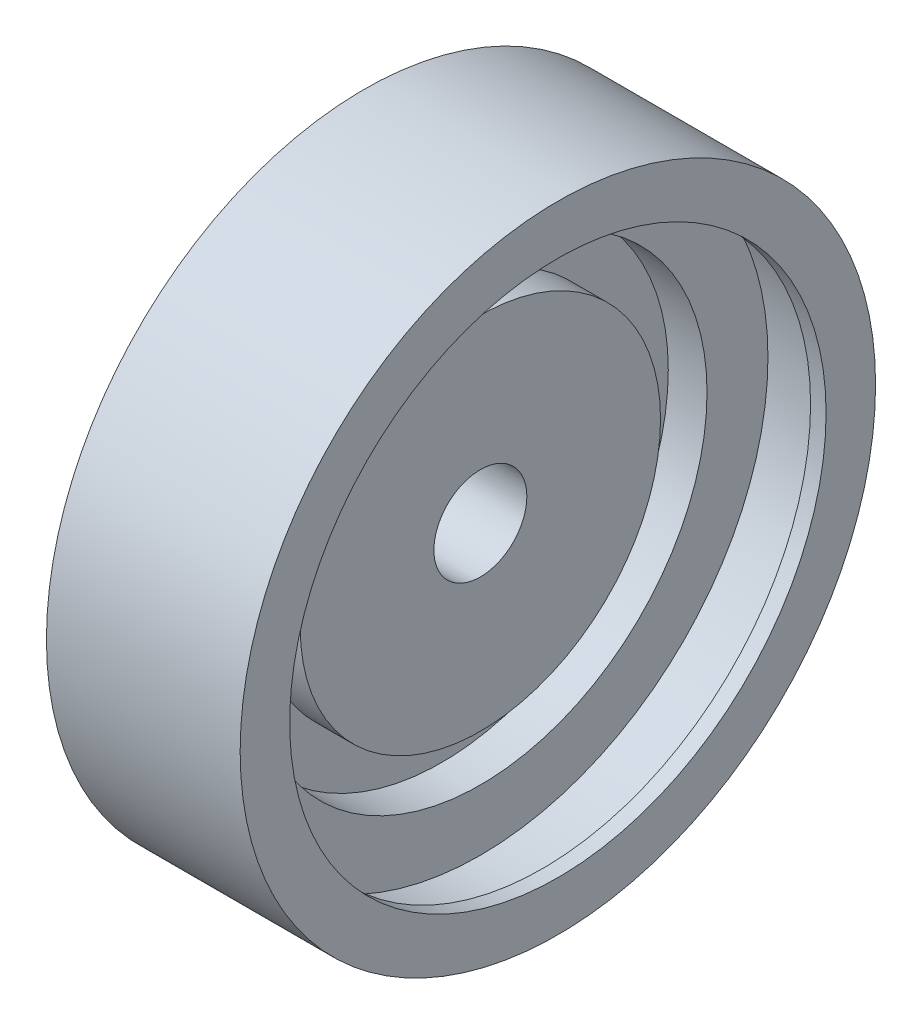
from build123d import *

# Parameters (mm, degrees)
CROQUIS1_R              = 41
CROQUIS1_R_2            = 37.1125
SALIENTE_EXTRUIR1_DEPTH = 10
SALIENTE_EXTRUIR2_START = 10
CROQUIS2_R              = 41
SALIENTE_EXTRUIR2_DEPTH = 10
CROQUIS3_R              = 29.25
CROQUIS3_R_2            = 23.25
CORTAR_EXTRUIR3_DEPTH   = 5
SALIENTE_EXTRUIR4_START = 5
CROQUIS6_R              = 41
SALIENTE_EXTRUIR4_DEPTH = 5
SALIENTE_EXTRUIR9_START = -2
CROQUIS8_R              = 41
CROQUIS8_R_2            = 34.6125
SALIENTE_EXTRUIR9_DEPTH = 2
CROQUIS9_R              = 6
CORTAR_EXTRUIR4_DEPTH   = 22


with BuildPart() as part:
    # Croquis1 → Saliente-Extruir1 (new body)
    with BuildSketch(Plane(origin=(0, 0, 0), x_dir=(0, 0, -1), z_dir=(1, 0, 0))):
        Circle(CROQUIS1_R)
        Circle(CROQUIS1_R_2, mode=Mode.SUBTRACT)
    extrude(amount=SALIENTE_EXTRUIR1_DEPTH)

    # Croquis2 → Saliente-Extruir2 (add)
    with BuildSketch(Plane.ZY.offset(SALIENTE_EXTRUIR2_START)):
        Circle(CROQUIS2_R)
    extrude(amount=-SALIENTE_EXTRUIR2_DEPTH)

    # Croquis3 → Cortar-Extruir3 (cut)
    with BuildSketch(Plane(origin=(0, 0, 0), x_dir=(0, 0, -1), z_dir=(1, 0, 0))):
        Circle(CROQUIS3_R)
        Circle(CROQUIS3_R_2, mode=Mode.SUBTRACT)
    extrude(amount=-CORTAR_EXTRUIR3_DEPTH, mode=Mode.SUBTRACT)

    # Croquis6 → Saliente-Extruir4 (add)
    with BuildSketch(Plane.ZY.offset(10).offset(SALIENTE_EXTRUIR4_START)):
        Circle(CROQUIS6_R)
    extrude(amount=-SALIENTE_EXTRUIR4_DEPTH)

    # Croquis8 → Saliente-Extruir9 (add)
    with BuildSketch(Plane(origin=(10, 0, 0), x_dir=(0, 0, -1), z_dir=(1, 0, 0)).offset(SALIENTE_EXTRUIR9_START)):
        Circle(CROQUIS8_R)
        Circle(CROQUIS8_R_2, mode=Mode.SUBTRACT)
    extrude(amount=SALIENTE_EXTRUIR9_DEPTH)

    # Croquis9 → Cortar-Extruir4 (cut)
    with BuildSketch(Plane(origin=(0, 0, 0), x_dir=(0, 0, -1), z_dir=(1, 0, 0))):
        Circle(CROQUIS9_R)
    extrude(amount=-CORTAR_EXTRUIR4_DEPTH, mode=Mode.SUBTRACT)


solid = part.part
